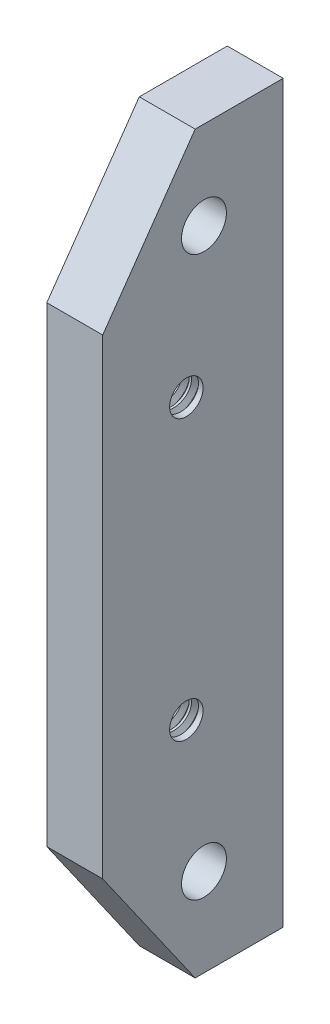
from build123d import *

# Parameters (mm, degrees)
BOSS_EXTRUDE1_DEPTH      = 3.175
BOSS_EXTRUDE1_DEPTH_BACK = 3.175
SKETCH1_W                = 20.5
SKETCH1_H                = 83.5
SKETCH1_R                = 2.55
SKETCH1_R_2              = 1.89865
CHAMFER1_SIZE            = 15
CHAMFER1_SIZE2           = 10.503113073
CHAMFER2_SIZE            = 15
CHAMFER2_SIZE2           = 10.503113073
THREAD1_PITCH            = 1.058333333
THREAD2_PITCH            = 1.058333333


with BuildPart() as part:
    # Sketch1 → Boss-Extrude1 (new, two sides: drawn at the far end of the back side and taken through both)
    with BuildSketch(Plane(origin=(0, 0, 0), x_dir=(0, 0, -1), z_dir=(1, 0, 0)).offset(-BOSS_EXTRUDE1_DEPTH_BACK)):
        with Locations((-1.25, 0)):
            Rectangle(SKETCH1_W, SKETCH1_H)
        with Locations((0, 31.75)):
            Circle(SKETCH1_R, mode=Mode.SUBTRACT)
        with Locations((0, -31.75)):
            Circle(SKETCH1_R, mode=Mode.SUBTRACT)
        with Locations((-2, 15.875)):
            Circle(SKETCH1_R_2, mode=Mode.SUBTRACT)
        with Locations((-2, -15.875)):
            Circle(SKETCH1_R_2, mode=Mode.SUBTRACT)
    extrude(amount=BOSS_EXTRUDE1_DEPTH + BOSS_EXTRUDE1_DEPTH_BACK)

    # Chamfer1
    chamfer1_edges = [part.edges().sort_by_distance(p)[0] for p in [
        (0, 41.75, 11.5),
    ]]
    chamfer1_side = [part.faces().sort_by_distance(p)[0] for p in [
        (0, 0, 11.5),
    ]]
    chamfer(chamfer1_edges, length=CHAMFER1_SIZE, length2=CHAMFER1_SIZE2, reference=chamfer1_side[0])

    # Chamfer2
    chamfer2_edges = [part.edges().sort_by_distance(p)[0] for p in [
        (0, -41.75, 11.5),
    ]]
    chamfer2_side = [part.faces().sort_by_distance(p)[0] for p in [
        (0, -7.5, 11.5),
    ]]
    chamfer(chamfer2_edges, length=CHAMFER2_SIZE, length2=CHAMFER2_SIZE2, reference=chamfer2_side[0])

    # Thread1: the profile of Thread Profile1 profile screwed along a right-hand helix of 9.448819 turns, 8 arcs to a turn; built about Z, then put on its axis
    thread1_z = Axis((0, 0, 0), (0, 0, 1))
    thread1_corners = [(1.89835, 0, -0.000173205), (2.471489718, 0, 0.330729165), (2.471489718, 0, 0.463020832), (1.89835, 0, 0.793923202)]
    with BuildLine(mode=Mode.PRIVATE) as thread1_profile:
        Line(thread1_corners[0], thread1_corners[1])
        Line(thread1_corners[1], thread1_corners[2])
        Line(thread1_corners[2], thread1_corners[3])
        Line(thread1_corners[3], thread1_corners[0])
    thread1_cap = Face(thread1_profile.wire())
    thread1_turn_angles = [0, 22.5, 45, 67.5, 90, 112.5, 135, 157.5, 180, 202.5, 225, 247.5, 270, 292.5, 315, 337.5, 360]
    thread1_turn_weights = [1, 0.9238795325112867, 1, 0.9238795325112867, 1, 0.9238795325112867, 1, 0.9238795325112867, 1, 0.9238795325112867, 1, 0.9238795325112867, 1, 0.9238795325112867, 1, 0.9238795325112867, 1]
    thread1_turn_rails = [Edge.make_bspline([Vector(p[0], p[1], 0).rotate(thread1_z, thread1_turn_angles[k]) / thread1_turn_weights[k] + Vector(0, 0, p[2] + THREAD1_PITCH * thread1_turn_angles[k] / 360) for k in range(17)], [0, 0, 0, 1, 1, 2, 2, 3, 3, 4, 4, 5, 5, 6, 6, 7, 7, 8, 8, 8], 2, thread1_turn_weights) for p in thread1_corners]
    thread1_turn_sides = [Face.make_surface_from_curves(thread1_turn_rails[p[0]], thread1_turn_rails[p[1]]) for p in [(0, 1), (1, 2), (2, 3), (3, 0)]]
    thread1_last_angles = [3240, 3262.5, 3285, 3307.5, 3330, 3352.5, 3375, 3388.287401575, 3401.57480315]
    thread1_last_weights = [1, 0.9238795325112867, 1, 0.9238795325112867, 1, 0.9238795325112867, 1, 0.9732294335070495, 1]
    thread1_last_rails = [Edge.make_bspline([Vector(p[0], p[1], 0).rotate(thread1_z, thread1_last_angles[k]) / thread1_last_weights[k] + Vector(0, 0, p[2] + THREAD1_PITCH * thread1_last_angles[k] / 360) for k in range(9)], [0, 0, 0, 1, 1, 2, 2, 3, 3, 4, 4, 4], 2, thread1_last_weights) for p in thread1_corners]
    thread1_last_sides = [Face.make_surface_from_curves(thread1_last_rails[p[0]], thread1_last_rails[p[1]]) for p in [(0, 1), (1, 2), (2, 3), (3, 0)]]
    thread1 = Plane(origin=(3.175, 15.875, 2), x_dir=(0, 0, 1), z_dir=(-1, 0, 0)) * Solid(Shell([*[p.moved(Location((0, 0, THREAD1_PITCH * i))) for i in range(9) for p in thread1_turn_sides], *thread1_last_sides, thread1_cap, thread1_cap.rotate(thread1_z, 3401.57480315).moved(Location((0, 0, THREAD1_PITCH * 3401.57480315 / 360)))]))
    add(thread1, mode=Mode.SUBTRACT)

    # Thread2: the profile of Thread Profile2 profile screwed along a right-hand helix of 9.448819 turns, 8 arcs to a turn; built about Z, then put on its axis
    thread2_z = Axis((0, 0, 0), (0, 0, 1))
    thread2_corners = [(1.89835, 0, -0.000173205), (2.471489718, 0, 0.330729165), (2.471489718, 0, 0.463020832), (1.89835, 0, 0.793923202)]
    with BuildLine(mode=Mode.PRIVATE) as thread2_profile:
        Line(thread2_corners[0], thread2_corners[1])
        Line(thread2_corners[1], thread2_corners[2])
        Line(thread2_corners[2], thread2_corners[3])
        Line(thread2_corners[3], thread2_corners[0])
    thread2_cap = Face(thread2_profile.wire())
    thread2_turn_angles = [0, 22.5, 45, 67.5, 90, 112.5, 135, 157.5, 180, 202.5, 225, 247.5, 270, 292.5, 315, 337.5, 360]
    thread2_turn_weights = [1, 0.9238795325112867, 1, 0.9238795325112867, 1, 0.9238795325112867, 1, 0.9238795325112867, 1, 0.9238795325112867, 1, 0.9238795325112867, 1, 0.9238795325112867, 1, 0.9238795325112867, 1]
    thread2_turn_rails = [Edge.make_bspline([Vector(p[0], p[1], 0).rotate(thread2_z, thread2_turn_angles[k]) / thread2_turn_weights[k] + Vector(0, 0, p[2] + THREAD2_PITCH * thread2_turn_angles[k] / 360) for k in range(17)], [0, 0, 0, 1, 1, 2, 2, 3, 3, 4, 4, 5, 5, 6, 6, 7, 7, 8, 8, 8], 2, thread2_turn_weights) for p in thread2_corners]
    thread2_turn_sides = [Face.make_surface_from_curves(thread2_turn_rails[p[0]], thread2_turn_rails[p[1]]) for p in [(0, 1), (1, 2), (2, 3), (3, 0)]]
    thread2_last_angles = [3240, 3262.5, 3285, 3307.5, 3330, 3352.5, 3375, 3388.287401575, 3401.57480315]
    thread2_last_weights = [1, 0.9238795325112867, 1, 0.9238795325112867, 1, 0.9238795325112867, 1, 0.9732294335070495, 1]
    thread2_last_rails = [Edge.make_bspline([Vector(p[0], p[1], 0).rotate(thread2_z, thread2_last_angles[k]) / thread2_last_weights[k] + Vector(0, 0, p[2] + THREAD2_PITCH * thread2_last_angles[k] / 360) for k in range(9)], [0, 0, 0, 1, 1, 2, 2, 3, 3, 4, 4, 4], 2, thread2_last_weights) for p in thread2_corners]
    thread2_last_sides = [Face.make_surface_from_curves(thread2_last_rails[p[0]], thread2_last_rails[p[1]]) for p in [(0, 1), (1, 2), (2, 3), (3, 0)]]
    thread2 = Plane(origin=(3.175, -15.875, 2), x_dir=(0, 0, 1), z_dir=(-1, 0, 0)) * Solid(Shell([*[p.moved(Location((0, 0, THREAD2_PITCH * i))) for i in range(9) for p in thread2_turn_sides], *thread2_last_sides, thread2_cap, thread2_cap.rotate(thread2_z, 3401.57480315).moved(Location((0, 0, THREAD2_PITCH * 3401.57480315 / 360)))]))
    add(thread2, mode=Mode.SUBTRACT)


solid = part.part
